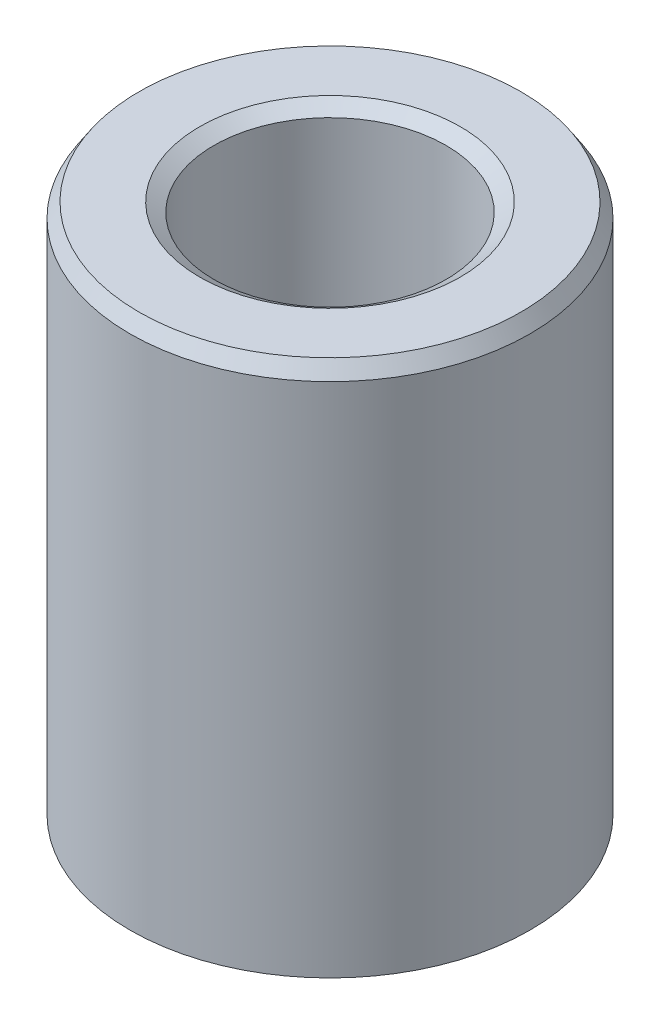
from build123d import *
from OCP.BRepFilletAPI import BRepFilletAPI_MakeChamfer

# Parameters (mm, degrees)
SKETCH1_R           = 47.5
BOSS_EXTRUDE1_DEPTH = 128.129675057
SKETCH2_R           = 27.566872028
CUT_EXTRUDE1_DEPTH  = 145.671053187
CHAMFER1_SIZE       = 3.372324905
CHAMFER1_SIZE2      = 2.174474139


with BuildPart() as part:
    # Sketch1 → Boss-Extrude1 (new body)
    with BuildSketch(Plane(origin=(0, 0, 0), x_dir=(1, 0, 0), z_dir=(0, 1, 0))):
        Circle(SKETCH1_R)
    extrude(amount=BOSS_EXTRUDE1_DEPTH)

    # Sketch2 → Cut-Extrude1 (cut, through all)
    with BuildSketch(Plane(origin=(0, 0, 0), x_dir=(1, 0, 0), z_dir=(0, 1, 0))):
        Circle(SKETCH2_R)
    extrude(amount=CUT_EXTRUDE1_DEPTH, mode=Mode.SUBTRACT)

    # Chamfer1: one chamfer whose edges measure the first distance from different faces: ONE call of the kernel's chamfer builder (chamfer() names one face for all edges)
    chamfer1_edges_1 = [part.edges().sort_by_distance(p)[0] for p in [
        (-27.566872028, 128.129675057, 0),
    ]]
    chamfer1_side_1 = [part.faces().sort_by_distance(p)[0] for p in [
        (-46.156497116, 128.129675057, 0),
    ]]
    chamfer1_edges_2 = [part.edges().sort_by_distance(p)[0] for p in [
        (-27.566872028, 0, 0),
    ]]
    chamfer1_side_2 = [part.faces().sort_by_distance(p)[0] for p in [
        (-27.566872028, 64.064837528, 0),
    ]]
    chamfer1_edges_3 = [part.edges().sort_by_distance(p)[0] for p in [
        (-47.5, 0, 0),
    ]]
    chamfer1_side_3 = [part.faces().sort_by_distance(p)[0] for p in [
        (-46.156497116, 0, 0),
    ]]
    chamfer1_edges_4 = [part.edges().sort_by_distance(p)[0] for p in [
        (-47.5, 128.129675057, 0),
    ]]
    chamfer1_side_4 = [part.faces().sort_by_distance(p)[0] for p in [
        (-47.5, 64.064837528, 0),
    ]]
    chamfer1 = BRepFilletAPI_MakeChamfer(part.part.solid().wrapped)
    for e in chamfer1_edges_1:
        chamfer1.Add(CHAMFER1_SIZE, CHAMFER1_SIZE2, e.wrapped, chamfer1_side_1[0].wrapped)  # the first distance lies on this face
    for e in chamfer1_edges_2:
        chamfer1.Add(CHAMFER1_SIZE, CHAMFER1_SIZE2, e.wrapped, chamfer1_side_2[0].wrapped)  # the first distance lies on this face
    for e in chamfer1_edges_3:
        chamfer1.Add(CHAMFER1_SIZE, CHAMFER1_SIZE2, e.wrapped, chamfer1_side_3[0].wrapped)  # the first distance lies on this face
    for e in chamfer1_edges_4:
        chamfer1.Add(CHAMFER1_SIZE, CHAMFER1_SIZE2, e.wrapped, chamfer1_side_4[0].wrapped)  # the first distance lies on this face
    add(Compound.cast(chamfer1.Shape()), mode=Mode.REPLACE)


solid = part.part
